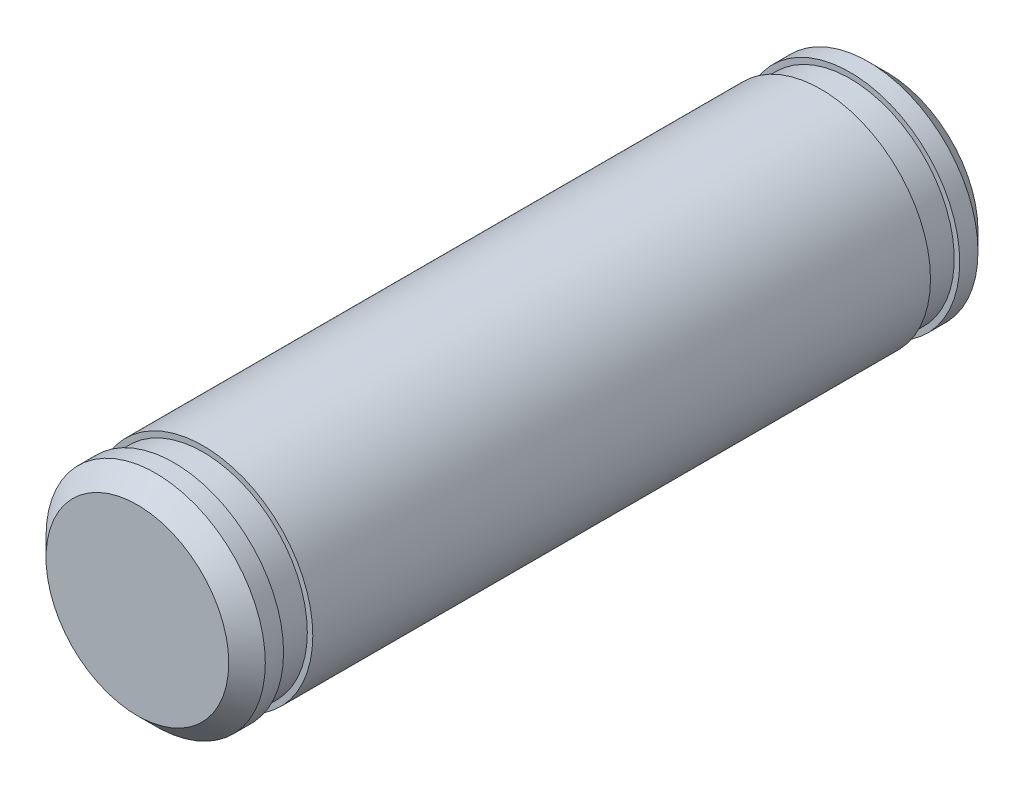
from build123d import *

# Parameters (mm, degrees)
SZKIC1_R                    = 3
DODANIE_WYCI_GNI_CIE1_DEPTH = 20.5
SFAZOWANIE1_SIZE            = 0.5
WYTNIJ_WYCI_GNI_CIE1_START  = -1.8
SZKIC2_R                    = 3
SZKIC2_R_2                  = 2.85
WYTNIJ_WYCI_GNI_CIE1_DEPTH  = 0.8
WYTNIJ_WYCI_GNI_CIE2_START  = -1
SZKIC3_R                    = 3
SZKIC3_R_2                  = 2.85
WYTNIJ_WYCI_GNI_CIE2_DEPTH  = 0.8


with BuildPart() as part:
    # Szkic1 → Dodanie-wyciągnięcie1 (new body)
    with BuildSketch(Plane.XY):
        Circle(SZKIC1_R)
    extrude(amount=DODANIE_WYCI_GNI_CIE1_DEPTH)

    # Sfazowanie1
    sfazowanie1_edges = [part.edges().sort_by_distance(p)[0] for p in [
        (-3, 0, 0),
        (-3, 0, 20.5),
    ]]
    chamfer(sfazowanie1_edges, length=SFAZOWANIE1_SIZE)

    # Szkic2 → Wytnij-wyciągnięcie1 (cut)
    with BuildSketch(Plane.XY.offset(20.5).offset(WYTNIJ_WYCI_GNI_CIE1_START)):
        Circle(SZKIC2_R)
        Circle(SZKIC2_R_2, mode=Mode.SUBTRACT)
    extrude(amount=WYTNIJ_WYCI_GNI_CIE1_DEPTH, mode=Mode.SUBTRACT)

    # Szkic3 → Wytnij-wyciągnięcie2 (cut)
    with BuildSketch(Plane(origin=(0, 0, 0), x_dir=(-1, 0, 0), z_dir=(0, 0, -1)).offset(WYTNIJ_WYCI_GNI_CIE2_START)):
        Circle(SZKIC3_R)
        Circle(SZKIC3_R_2, mode=Mode.SUBTRACT)
    extrude(amount=-WYTNIJ_WYCI_GNI_CIE2_DEPTH, mode=Mode.SUBTRACT)


solid = part.part
